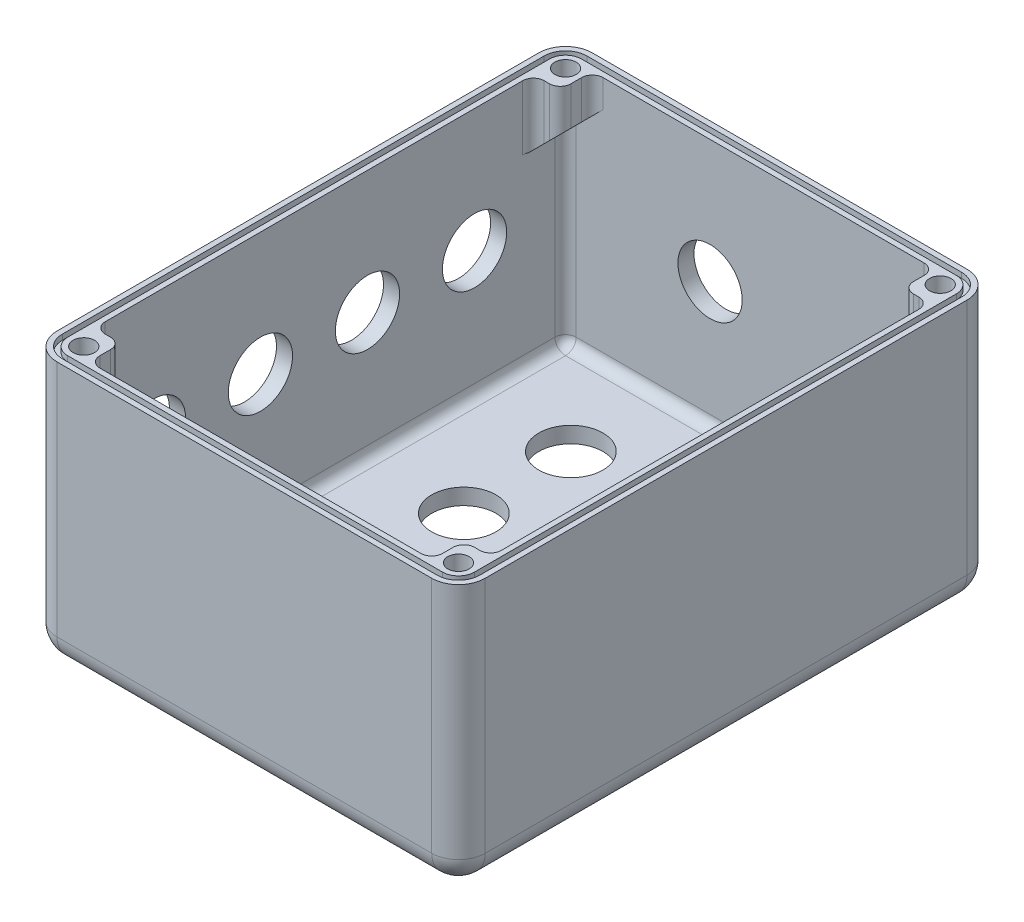
from build123d import *

# Parameters (mm, degrees)
SKICA1_W                     = 80
SKICA1_H                     = 100
P_IDAT_VYSUNUT_M1_DEPTH      = 49.5
ZAOBLIT1_R                   = 5
SKO_EPINA1_T                 = -3
F_12_0_12_PR_M_R_D_RY1_D     = 12
ODEBRAT_VYSUNUT_M1_DEPTH     = 1
SKICA6_W                     = 7
SKICA6_H                     = 8
SKICA6_W_2                   = 4
P_IDAT_VYSUNUT_M2_DEPTH      = 2
SKICA7_W                     = 4
SKICA7_H                     = 2
SKICA7_W_2                   = 7
P_IDAT_VYSUNUT_M3_DEPTH      = 42
ZAOBLIT2_R                   = 2
ZKOSEN_1_SIZE                = 2
F_12_0_12_PR_M_R_D_RY2_D     = 12
F_12_0_12_PR_M_R_D_RY2_DEPTH = 5
F_12_0_12_PR_M_R_D_RY2_TIP   = 3.605163714
F_12_0_12_PR_M_R_D_RY3_D     = 12
F_12_0_12_PR_M_R_D_RY3_DEPTH = 5
F_12_0_12_PR_M_R_D_RY3_TIP   = 3.605163714
SKICA12_W                    = 5
SKICA12_H                    = 6
P_IDAT_VYSUNUT_M9_DEPTH      = 12
ZRCADLIT2_COPY_1_SKETCH_W    = 5
ZRCADLIT2_COPY_1_SKETCH_H    = 6
ZRCADLIT2_COPY_1_DEPTH       = 12
ZKOSEN_2_SIZE                = 4.8
ZAOBLIT3_R                   = 2


# Some blends are built 0.0001 mm under size
with BuildPart() as part:
    # Skica1 → Přidat vysunutím1 (new body)
    with BuildSketch(Plane(origin=(0, 0, 0), x_dir=(1, 0, 0), z_dir=(0, 1, 0))):
        Rectangle(SKICA1_W, SKICA1_H)
    extrude(amount=P_IDAT_VYSUNUT_M1_DEPTH)

    # Zaoblit1
    zaoblit1_edges = [part.edges().sort_by_distance(p)[0] for p in [
        (0, 0, -50),
        (40, 0, 0),
        (0, 0, 50),
        (-40, 0, 0),
        (-40, 24.75, -50),
        (40, 24.75, -50),
        (40, 24.75, 50),
        (-40, 24.75, 50),
    ]]
    fillet(zaoblit1_edges, radius=ZAOBLIT1_R)

    # Skořepina1
    sko_epina1_openings = [part.faces().sort_by_distance(p)[0] for p in [
        (0, 49.5, 0),
    ]]
    offset(amount=SKO_EPINA1_T, openings=sko_epina1_openings, kind=Kind.INTERSECTION)

    # Ø12.0 (12) průměr díry1 (through all)
    with Locations(Plane(origin=(0, 0, 0), x_dir=(-1, 0, 0), z_dir=(0, -1, 0))):
        with Locations((-1, 30), (-1, 10), (-1, -10), (-1, -30), (19, -30), (19, -10), (19, 10), (19, 30)):
            Hole(F_12_0_12_PR_M_R_D_RY1_D / 2)

    # Skica4 → Odebrat vysunutím1 (cut)
    with BuildSketch(Plane(origin=(0, 49.5, 0), x_dir=(1, 0, 0), z_dir=(0, 1, 0))):
        with BuildLine():
            Line((35, 49), (-35, 49))
            ThreePointArc((-35, 49), (-37.828427125, 47.828427125), (-39, 45))
            Line((-39, 45), (-39, -45))
            ThreePointArc((-39, -45), (-37.828427125, -47.828427125), (-35, -49))
            Line((-35, -49), (35, -49))
            ThreePointArc((35, -49), (37.828427125, -47.828427125), (39, -45))
            Line((39, -45), (39, 45))
            ThreePointArc((39, 45), (37.828427125, 47.828427125), (35, 49))
        make_face()
        with BuildLine():
            Line((-35, -48), (35, -48))
            ThreePointArc((35, -48), (37.121320344, -47.121320344), (38, -45))
            Line((38, -45), (38, 45))
            ThreePointArc((38, 45), (37.121320344, 47.121320344), (35, 48))
            Line((35, 48), (-35, 48))
            ThreePointArc((-35, 48), (-37.121320344, 47.121320344), (-38, 45))
            Line((-38, 45), (-38, -45))
            ThreePointArc((-38, -45), (-37.121320344, -47.121320344), (-35, -48))
        make_face(mode=Mode.SUBTRACT)
    extrude(amount=-ODEBRAT_VYSUNUT_M1_DEPTH, mode=Mode.SUBTRACT)

    # Skica6 → Přidat vysunutím2 (add)
    with BuildSketch(Plane(origin=(0, 3, 0), x_dir=(1, 0, 0), z_dir=(0, 1, 0))):
        with Locations((33.5, 29)):
            Rectangle(SKICA6_W, SKICA6_H)
        with Locations((26.2, 29)):
            Rectangle(SKICA6_W_2, SKICA6_H)
    extrude(amount=P_IDAT_VYSUNUT_M2_DEPTH)

    # Skica7 → Přidat vysunutím3 (add)
    with BuildSketch(Plane(origin=(0, 3, 0), x_dir=(1, 0, 0), z_dir=(0, 1, 0))):
        with Locations((26.2, -46)):
            Rectangle(SKICA7_W, SKICA7_H)
        with Locations((33.5, -46)):
            Rectangle(SKICA7_W_2, SKICA7_H)
    extrude(amount=P_IDAT_VYSUNUT_M3_DEPTH)

    # Zaoblit2
    # the kernel refuses this fillet: 2 mm, written as the material it adds along each edge
    with BuildSketch(Plane(origin=(24.2, 3, 45), x_dir=(0, 0, -1), z_dir=(1, 0, 0))) as zaoblit2_piece_1:
        with BuildLine():
            CenterArc((ZAOBLIT2_R, ZAOBLIT2_R), ZAOBLIT2_R, 180, 90)
            Line((0, ZAOBLIT2_R), (0, 0))
            Line((0, 0), (ZAOBLIT2_R, 0))
        make_face()
    extrude(amount=4)
    with BuildSketch(Plane(origin=(24.2, 3, 45), x_dir=(0, 0, -1), z_dir=(1, 0, 0))) as zaoblit2_piece_2_section:
        with BuildLine():
            CenterArc((ZAOBLIT2_R, ZAOBLIT2_R), ZAOBLIT2_R, 180, 90)
            Line((0, ZAOBLIT2_R), (0, 0))
            Line((0, 0), (ZAOBLIT2_R, 0))
        make_face()
    zaoblit2_piece_2 = extrude(amount=9, mode=Mode.PRIVATE)
    zaoblit2_piece_2 = split(zaoblit2_piece_2, bisect_by=Plane(origin=(30, 3.452790229, 44.547209771), z_dir=(1, 0, 0)), keep=Keep.TOP, mode=Mode.PRIVATE)
    add(zaoblit2_piece_2)
    with BuildSketch(Plane(origin=(37, 5, 45), x_dir=(-1, 0, 0), z_dir=(0, 1, 0))) as zaoblit2_piece_3:
        with BuildLine():
            CenterArc((ZAOBLIT2_R, -ZAOBLIT2_R), ZAOBLIT2_R, 90, 90)
            Line((0, -ZAOBLIT2_R), (0, 0))
            Line((0, 0), (ZAOBLIT2_R, 0))
        make_face()
    extrude(amount=40)
    with BuildSketch(Plane(origin=(25, 3, 45), x_dir=(0, 0, -1), z_dir=(1, 0, 0))) as zaoblit2_piece_4_section:
        with BuildLine():
            CenterArc((ZAOBLIT2_R, ZAOBLIT2_R), ZAOBLIT2_R, 180, 90)
            Line((0, ZAOBLIT2_R), (0, 0))
            Line((0, 0), (ZAOBLIT2_R, 0))
        make_face()
    zaoblit2_piece_4 = extrude(amount=10, mode=Mode.PRIVATE)
    zaoblit2_piece_4 = split(zaoblit2_piece_4, bisect_by=Plane(origin=(28.2, 3.452790229, 44.547209771), z_dir=(-1, 0, 0)), keep=Keep.TOP, mode=Mode.PRIVATE)
    add(zaoblit2_piece_4)
    with BuildSketch(Plane(origin=(30, 3, 45), x_dir=(0, 0, -1), z_dir=(1, 0, 0))) as zaoblit2_piece_5:
        with BuildLine():
            CenterArc((ZAOBLIT2_R, ZAOBLIT2_R), ZAOBLIT2_R, 180, 90)
            Line((0, ZAOBLIT2_R), (0, 0))
            Line((0, 0), (ZAOBLIT2_R, 0))
        make_face()
    extrude(amount=5)
    with BuildSketch(Plane(origin=(35, 5, 45), x_dir=(0, -1, 0), z_dir=(-1, 0, 0))) as zaoblit2_piece_6:
        with BuildLine():
            CenterArc((2 - ZAOBLIT2_R, -ZAOBLIT2_R), ZAOBLIT2_R, 0, 90)
            Line((2 - ZAOBLIT2_R, 0), (2, 0))
            Line((2, 0), (2, -ZAOBLIT2_R))
        make_face()
    revolve(axis=Axis((35, 5, 45), (0, 0, 1)), revolution_arc=90)

    # Zkosení1
    zkosen_1_edges = [part.edges().sort_by_distance(p)[0] for p in [
        (24.2, 5, -29),
    ]]
    chamfer(zkosen_1_edges, length=ZKOSEN_1_SIZE - 0.0001)  # a hair under: the kernel refuses the full size

    # Ø12.0 (12) průměr díry2
    with Locations(Plane.ZY.offset(40)):
        with Locations((-30, 26.5), (-10, 26.5), (10, 26.5), (30, 26.5)):
            Hole(F_12_0_12_PR_M_R_D_RY2_D / 2, depth=F_12_0_12_PR_M_R_D_RY2_DEPTH)
            with Locations((0, 0, -(F_12_0_12_PR_M_R_D_RY2_DEPTH + F_12_0_12_PR_M_R_D_RY2_TIP / 2))):  # 118° drill point
                Cone(0, F_12_0_12_PR_M_R_D_RY2_D / 2, F_12_0_12_PR_M_R_D_RY2_TIP, mode=Mode.SUBTRACT)

    # Ø12.0 (12) průměr díry3
    with Locations(Plane(origin=(0, 0, -50), x_dir=(-1, 0, 0), z_dir=(0, 0, -1))):
        with Locations((10, 26.5)):
            Hole(F_12_0_12_PR_M_R_D_RY3_D / 2, depth=F_12_0_12_PR_M_R_D_RY3_DEPTH)
            with Locations((0, 0, -(F_12_0_12_PR_M_R_D_RY3_DEPTH + F_12_0_12_PR_M_R_D_RY3_TIP / 2))):  # 118° drill point
                Cone(0, F_12_0_12_PR_M_R_D_RY3_D / 2, F_12_0_12_PR_M_R_D_RY3_TIP, mode=Mode.SUBTRACT)

    # Skica12 → Přidat vysunutím9 (add)
    with BuildSketch(Plane(origin=(0, 49.5, 0), x_dir=(1, 0, 0), z_dir=(0, 1, 0))):
        with Locations((34.5, 44)):
            Rectangle(SKICA12_W, SKICA12_H)
    p_idat_vysunut_m9 = extrude(amount=-P_IDAT_VYSUNUT_M9_DEPTH)

    # Skica15 → Ø4.0 (4) průměr díry2 (revolve, cut)
    with BuildSketch(Plane(origin=(35, 49.5, -45), x_dir=(0, 0, 1), z_dir=(1, 0, 0))):
        Polygon((0, 0), (0, 8.201721238), (2, 7), (2, 0), align=None)
    f_4_0_4_pr_m_r_d_ry2 = revolve(axis=Axis((35, 55.85, -45), (0, -1, 0)), mode=Mode.SUBTRACT)

    # Zrcadlit1: Přidat vysunutím9, Ø4.0 (4) průměr díry2 across plane
    add(p_idat_vysunut_m9.mirror(Plane.XY))
    add(f_4_0_4_pr_m_r_d_ry2.mirror(Plane.XY), mode=Mode.SUBTRACT)

    # Zrcadlit2: Přidat vysunutím9, Ø4.0 (4) průměr díry2 across plane
    add(p_idat_vysunut_m9.mirror(Plane(origin=(0, 0, 0), x_dir=(0, 0, 1), z_dir=(1, 0, 0))))
    add(f_4_0_4_pr_m_r_d_ry2.mirror(Plane(origin=(0, 0, 0), x_dir=(0, 0, 1), z_dir=(1, 0, 0))), mode=Mode.SUBTRACT)

    # Zrcadlit2 copy 1 sketch → Zrcadlit2 copy 1 (add)
    with BuildSketch(Plane(origin=(0, 49.5, 0), x_dir=(-1, 0, 0), z_dir=(0, 1, 0))):
        with Locations((34.5, 44)):
            Rectangle(ZRCADLIT2_COPY_1_SKETCH_W, ZRCADLIT2_COPY_1_SKETCH_H)
    extrude(amount=-ZRCADLIT2_COPY_1_DEPTH)

    # Zrcadlit2 copy 2 sketch → Zrcadlit2 copy 2 (revolve, cut)
    with BuildSketch(Plane(origin=(-35, 49.5, 45), x_dir=(0, 0, -1), z_dir=(-1, 0, 0))):
        Polygon((0, 0), (0, 8.201721238), (2, 7), (2, 0), align=None)
    revolve(axis=Axis((-35, 55.85, 45), (0, -1, 0)), mode=Mode.SUBTRACT)

    # Zkosení2
    zkosen_2_edges = [part.edges().sort_by_distance(p)[0] for p in [
        (32, 37.5, -44),
        (32, 37.5, 43),
        (-32, 37.5, -44),
        (-32, 37.5, 44),
    ]]
    chamfer(zkosen_2_edges, length=ZKOSEN_2_SIZE)

    # Zaoblit3
    # the kernel refuses this fillet: 2 mm, written as the material it adds along each edge
    with BuildSketch(Plane(origin=(32, 49.5, -47), x_dir=(-1, 0, 0), z_dir=(0, -1, 0))) as zaoblit3_piece_1_section:
        with BuildLine():
            CenterArc((ZAOBLIT3_R, -ZAOBLIT3_R), ZAOBLIT3_R, 90, 90)
            Line((0, -ZAOBLIT3_R), (0, 0))
            Line((0, 0), (ZAOBLIT3_R, 0))
        make_face()
    zaoblit3_piece_1 = extrude(amount=12.2, mode=Mode.PRIVATE)
    zaoblit3_piece_1 = split(zaoblit3_piece_1, bisect_by=Plane(origin=(29.880566615, 44.419433385, -46.541013269), z_dir=(0.7071067811865476, 0.7071067811865476, 0)), keep=Keep.TOP, mode=Mode.PRIVATE)
    add(zaoblit3_piece_1)
    with BuildSketch(Plane(origin=(37, 49.5, -41), x_dir=(-1, 0, 0), z_dir=(0, -1, 0))) as zaoblit3_piece_2_section:
        with BuildLine():
            CenterArc((ZAOBLIT3_R, -ZAOBLIT3_R), ZAOBLIT3_R, 90, 90)
            Line((0, -ZAOBLIT3_R), (0, 0))
            Line((0, 0), (ZAOBLIT3_R, 0))
        make_face()
    zaoblit3_piece_2 = extrude(amount=12, mode=Mode.PRIVATE)
    zaoblit3_piece_2 = split(zaoblit3_piece_2, bisect_by=Plane(origin=(33.613954856, 40.686045144, -40.547204847), z_dir=(0.7071067811865476, 0.7071067811865476, 0)), keep=Keep.TOP, mode=Mode.PRIVATE)
    add(zaoblit3_piece_2)
    with BuildSketch(Plane(origin=(-32, 49.5, -47), x_dir=(1, 0, 0), z_dir=(0, -1, 0))) as zaoblit3_piece_3_section:
        with BuildLine():
            CenterArc((ZAOBLIT3_R, ZAOBLIT3_R), ZAOBLIT3_R, 180, 90)
            Line((0, ZAOBLIT3_R), (0, 0))
            Line((0, 0), (ZAOBLIT3_R, 0))
        make_face()
    zaoblit3_piece_3 = extrude(amount=12.2, mode=Mode.PRIVATE)
    zaoblit3_piece_3 = split(zaoblit3_piece_3, bisect_by=Plane(origin=(-29.880566615, 44.419433385, -46.541013269), z_dir=(-0.7071067811865476, 0.7071067811865476, 0)), keep=Keep.TOP, mode=Mode.PRIVATE)
    add(zaoblit3_piece_3)
    with BuildSketch(Plane(origin=(-37, 49.5, -41), x_dir=(0, 0, 1), z_dir=(0, -1, 0))) as zaoblit3_piece_4_section:
        with BuildLine():
            CenterArc((ZAOBLIT3_R, -ZAOBLIT3_R), ZAOBLIT3_R, 90, 90)
            Line((0, -ZAOBLIT3_R), (0, 0))
            Line((0, 0), (ZAOBLIT3_R, 0))
        make_face()
    zaoblit3_piece_4 = extrude(amount=12, mode=Mode.PRIVATE)
    zaoblit3_piece_4 = split(zaoblit3_piece_4, bisect_by=Plane(origin=(-33.613954856, 40.686045144, -40.547204847), z_dir=(-0.7071067811865476, 0.7071067811865476, 0)), keep=Keep.TOP, mode=Mode.PRIVATE)
    add(zaoblit3_piece_4)
    with BuildSketch(Plane(origin=(-32, 49.5, 47), x_dir=(1, 0, 0), z_dir=(0, -1, 0))) as zaoblit3_piece_5_section:
        with BuildLine():
            CenterArc((ZAOBLIT3_R, -ZAOBLIT3_R), ZAOBLIT3_R, 90, 90)
            Line((0, -ZAOBLIT3_R), (0, 0))
            Line((0, 0), (ZAOBLIT3_R, 0))
        make_face()
    zaoblit3_piece_5 = extrude(amount=12.2, mode=Mode.PRIVATE)
    zaoblit3_piece_5 = split(zaoblit3_piece_5, bisect_by=Plane(origin=(-29.880566615, 44.419433385, 46.541013269), z_dir=(-0.7071067811865476, 0.7071067811865476, 0)), keep=Keep.TOP, mode=Mode.PRIVATE)
    add(zaoblit3_piece_5)
    with BuildSketch(Plane(origin=(-37, 49.5, 41), x_dir=(1, 0, 0), z_dir=(0, -1, 0))) as zaoblit3_piece_6_section:
        with BuildLine():
            CenterArc((ZAOBLIT3_R, -ZAOBLIT3_R), ZAOBLIT3_R, 90, 90)
            Line((0, -ZAOBLIT3_R), (0, 0))
            Line((0, 0), (ZAOBLIT3_R, 0))
        make_face()
    zaoblit3_piece_6 = extrude(amount=12, mode=Mode.PRIVATE)
    zaoblit3_piece_6 = split(zaoblit3_piece_6, bisect_by=Plane(origin=(-33.613954856, 40.686045144, 40.547204847), z_dir=(-0.7071067811865476, 0.7071067811865476, 0)), keep=Keep.TOP, mode=Mode.PRIVATE)
    add(zaoblit3_piece_6)
    with BuildSketch(Plane(origin=(37, 49.5, 41), x_dir=(-1, 0, 0), z_dir=(0, -1, 0))) as zaoblit3_piece_7_section:
        with BuildLine():
            CenterArc((ZAOBLIT3_R, ZAOBLIT3_R), ZAOBLIT3_R, 180, 90)
            Line((0, ZAOBLIT3_R), (0, 0))
            Line((0, 0), (ZAOBLIT3_R, 0))
        make_face()
    zaoblit3_piece_7 = extrude(amount=12, mode=Mode.PRIVATE)
    zaoblit3_piece_7 = split(zaoblit3_piece_7, bisect_by=Plane(origin=(33.613954856, 40.686045144, 40.547204847), z_dir=(0.7071067811865476, 0.7071067811865476, 0)), keep=Keep.TOP, mode=Mode.PRIVATE)
    add(zaoblit3_piece_7)
    with BuildSketch(Plane(origin=(32, 49.5, 47), x_dir=(-1, 0, 0), z_dir=(0, -1, 0))) as zaoblit3_piece_8:
        with BuildLine():
            CenterArc((ZAOBLIT3_R, ZAOBLIT3_R), ZAOBLIT3_R, 180, 90)
            Line((0, ZAOBLIT3_R), (0, 0))
            Line((0, 0), (ZAOBLIT3_R, 0))
        make_face()
    extrude(amount=9.5)
    # the kernel refuses this fillet: 2 mm, written as the material it takes off along each edge
    with BuildSketch(Plane(origin=(32, 54.5, -41), x_dir=(1, 0, 0), z_dir=(0, -1, 0)), Plane(origin=(-32, 54.5, 41), x_dir=(-1, 0, 0), z_dir=(0, -1, 0))) as zaoblit3_2_piece_1:
        with BuildLine():
            CenterArc((ZAOBLIT3_R, -ZAOBLIT3_R), ZAOBLIT3_R, 90, 90)
            Line((0, -ZAOBLIT3_R), (0, 0))
            Line((0, 0), (ZAOBLIT3_R, 0))
        make_face()
    extrude(amount=17.2, mode=Mode.SUBTRACT)
    with BuildSketch(Plane(origin=(-32, 54.5, -41), x_dir=(-1, 0, 0), z_dir=(0, -1, 0)), Plane(origin=(32, 54.5, 41), x_dir=(1, 0, 0), z_dir=(0, -1, 0))) as zaoblit3_2_piece_2:
        with BuildLine():
            CenterArc((ZAOBLIT3_R, ZAOBLIT3_R), ZAOBLIT3_R, 180, 90)
            Line((0, ZAOBLIT3_R), (0, 0))
            Line((0, 0), (ZAOBLIT3_R, 0))
        make_face()
    extrude(amount=17.2, mode=Mode.SUBTRACT)


solid = part.part
